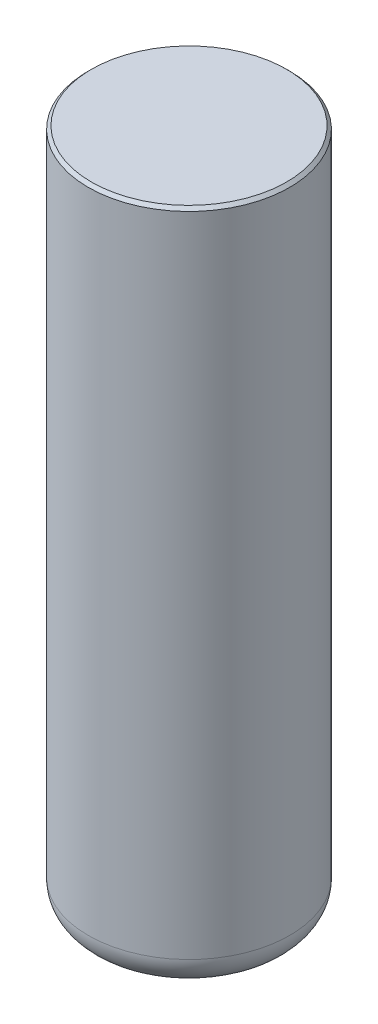
from build123d import *

# Parameters (mm, degrees)
SKETCH1_R           = 32.5
BOSS_EXTRUDE1_DEPTH = 220
FILLET1_R           = 10
CHAMFER1_SIZE       = 1


with BuildPart() as part:
    # Sketch1 → Boss-Extrude1 (new body)
    with BuildSketch(Plane(origin=(0, 0, 0), x_dir=(1, 0, 0), z_dir=(0, 1, 0))):
        Circle(SKETCH1_R)
    extrude(amount=BOSS_EXTRUDE1_DEPTH)

    # Fillet1
    fillet1_edges = [part.edges().sort_by_distance(p)[0] for p in [
        (-32.5, 0, 0),
    ]]
    fillet(fillet1_edges, radius=FILLET1_R)

    # Chamfer1
    chamfer1_edges = [part.edges().sort_by_distance(p)[0] for p in [
        (-32.5, 220, 0),
    ]]
    chamfer(chamfer1_edges, length=CHAMFER1_SIZE)


solid = part.part
